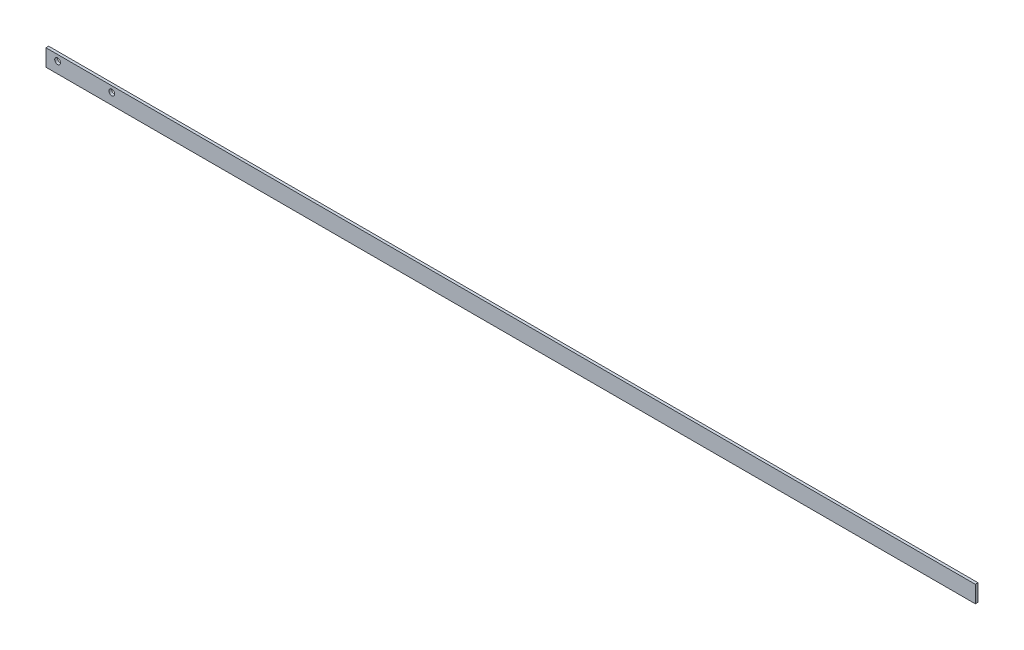
from build123d import *

# Parameters (mm, degrees)
SKETCH1_W             = 609.6
SKETCH1_H             = 11.0998
BOSS_EXTRUDE1_DEPTH   = 0.889
F_6_CLEARANCE_HOLE1_D = 3.7973


with BuildPart() as part:
    # Sketch1 → Boss-Extrude1 (new, symmetric)
    with BuildSketch(Plane.XY):
        Rectangle(SKETCH1_W, SKETCH1_H)
    extrude(amount=BOSS_EXTRUDE1_DEPTH, both=True)

    # #6 Clearance Hole1 (through all)
    with Locations(Plane.XY.offset(0.889)):
        with Locations((-297.18, 1.7399), (-261.62, 1.7399)):
            Hole(F_6_CLEARANCE_HOLE1_D / 2)


solid = part.part
